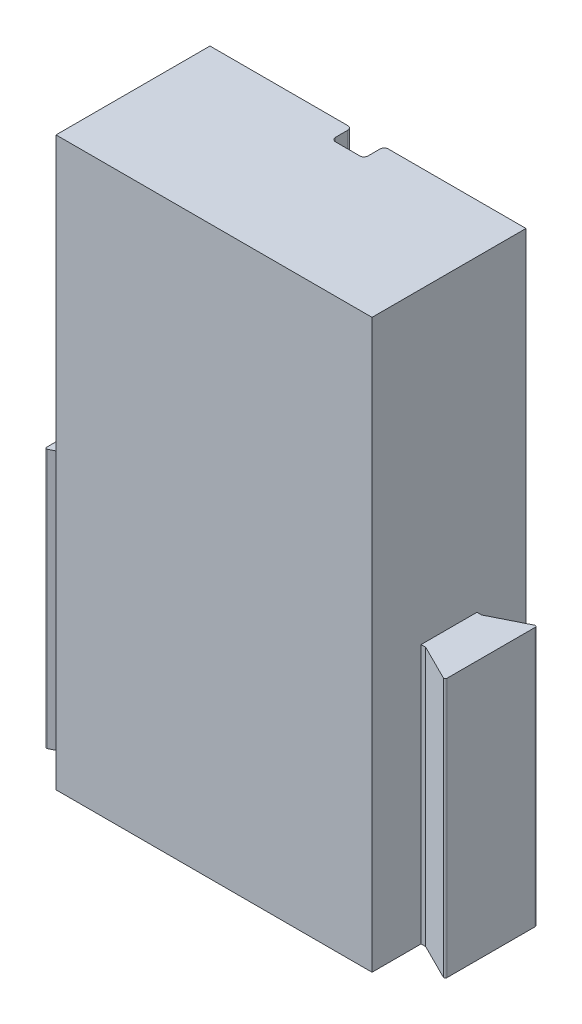
from build123d import *

# Parameters (mm, degrees)
SKETCH1_W           = 39
SKETCH1_H           = 19
BOSS_EXTRUDE1_DEPTH = 70
SKETCH3_R           = 4.125
SKETCH3_R_2         = 2.25
CUT_EXTRUDE2_DEPTH  = 5
BOSS_EXTRUDE3_DEPTH = 32
SKETCH5_W           = 2.25
SKETCH5_H           = 5.5
CUT_EXTRUDE1_DEPTH  = 10
CHAMFER1_SIZE       = 5
SKETCH6_W           = 4
SKETCH6_H           = 2.5
CUT_EXTRUDE3_DEPTH  = 75.835419422
FILLET2_R           = 0.5


with BuildPart() as part:
    # Sketch1 → Boss-Extrude1 (new body)
    with BuildSketch(Plane(origin=(0, 0, 0), x_dir=(1, 0, 0), z_dir=(0, 1, 0))):
        Rectangle(SKETCH1_W, SKETCH1_H)
    extrude(amount=BOSS_EXTRUDE1_DEPTH)

    # Sketch3 → Cut-Extrude2 (cut)
    with BuildSketch(Plane.XZ):
        Circle(SKETCH3_R)
        Circle(SKETCH3_R_2, mode=Mode.SUBTRACT)
    extrude(amount=-CUT_EXTRUDE2_DEPTH, mode=Mode.SUBTRACT)

    # Sketch4 → Boss-Extrude3 (add)
    with BuildSketch(Plane.XZ):
        with BuildLine():
            Line((19.5, -3.45), (20.070820393, -3.45))
            Line((20.070820393, -3.45), (24.410557281, -5.619868444))
            ThreePointArc((24.410557281, -5.619868444), (24.605146222, -5.611113167), (24.7, -5.440983006))
            Line((24.7, -5.440983006), (24.7, 5.440983006))
            ThreePointArc((24.7, 5.440983006), (24.605146222, 5.611113167), (24.410557281, 5.619868444))
            Line((24.410557281, 5.619868444), (20.070820393, 3.45))
            Line((20.070820393, 3.45), (19.5, 3.45))
            Line((19.5, 3.45), (19.5, -3.45))
        make_face()
        with BuildLine():
            Line((-20.070820393, -3.45), (-19.5, -3.45))
            Line((-19.5, -3.45), (-19.5, 3.45))
            Line((-19.5, 3.45), (-20.070820393, 3.45))
            Line((-20.070820393, 3.45), (-24.410557281, 5.619868444))
            ThreePointArc((-24.410557281, 5.619868444), (-24.605146222, 5.611113167), (-24.7, 5.440983006))
            Line((-24.7, 5.440983006), (-24.7, -5.440983006))
            ThreePointArc((-24.7, -5.440983006), (-24.605146222, -5.611113167), (-24.410557281, -5.619868444))
            Line((-24.410557281, -5.619868444), (-20.070820393, -3.45))
        make_face()
    extrude(amount=-BOSS_EXTRUDE3_DEPTH)

    # Sketch5 → Cut-Extrude1 (cut)
    with BuildSketch(Plane(origin=(0, 0, -9.5), x_dir=(-1, 0, 0), z_dir=(0, 0, -1))):
        with Locations((0, 17.75)):
            Rectangle(SKETCH5_W, SKETCH5_H)
    extrude(amount=-CUT_EXTRUDE1_DEPTH, mode=Mode.SUBTRACT)

    # Chamfer1
    chamfer1_edges = [part.edges().sort_by_distance(p)[0] for p in [
        (0, 15, -9.5),
        (0, 20.5, -9.5),
    ]]
    chamfer(chamfer1_edges, length=CHAMFER1_SIZE)

    # Sketch6 → Cut-Extrude3 (cut, through all)
    with BuildSketch(Plane(origin=(0, 70, 0), x_dir=(1, 0, 0), z_dir=(0, 1, 0))):
        with Locations((0, 8.25)):
            Rectangle(SKETCH6_W, SKETCH6_H)
    extrude(amount=-CUT_EXTRUDE3_DEPTH, mode=Mode.SUBTRACT)

    # Fillet2
    fillet2_edges = [part.edges().sort_by_distance(p)[0] for p in [
        (2, 35, -7),
        (-2, 35, -7),
        (2, 35, -9.5),
        (-2, 35, -9.5),
    ]]
    fillet(fillet2_edges, radius=FILLET2_R)


solid = part.part
